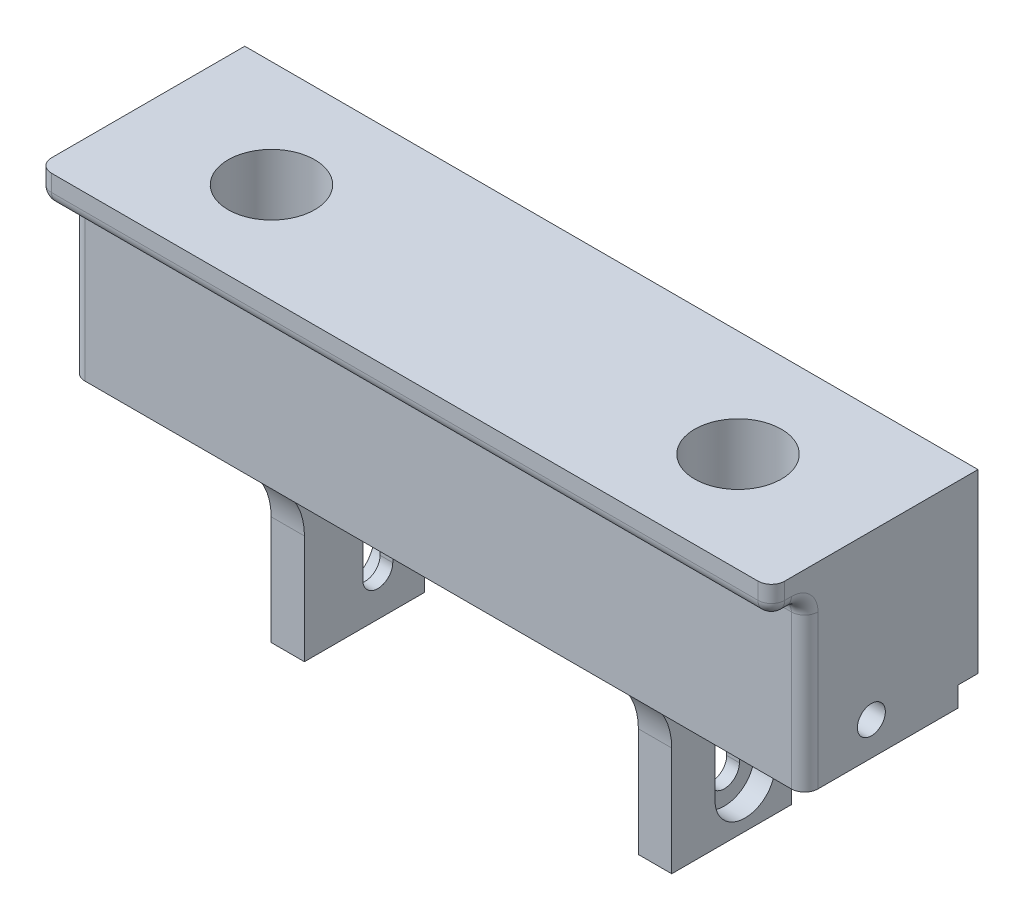
from build123d import *

# Parameters (mm, degrees)
AUFSATZ_LINEAR_AUSTRAGEN2_DEPTH                = 13
STIRNSENKUNG_START                             = 26.95
STIRNSENKUNG_LANGLOCH_F_R_M4_FLACHKOPFSC_DEPTH = 3.1
STIRNSENKUNG_START_2                           = 25.05
STIRNSENKUNG_LANGLOCH_F_R_M4_FLACHKO_3_DEPTH   = 1.9
SCHNITT_LINEAR_AUSTRAGEN1_DEPTH                = 91.954672777
SCHNITT_LINEAR_AUSTRAGEN1_DEPTH_BACK           = 91.954672777
VERRUNDUNG1_R                                  = 10
AUFSATZ_LINEAR_AUSTRAGEN4_REACH                = 65.751
SKIZZE9_W                                      = 3
SKIZZE9_H                                      = 26.5
AUFSATZ_LINEAR_AUSTRAGEN4_DIRECTION_2_REACH    = 65.751
SKIZZE18_W                                     = 110
SKIZZE18_H                                     = 4.5
AUFSATZ_LINEAR_AUSTRAGEN5_DEPTH                = 2
F_4_2_4_2_DURCHMESSER_BOHRUNG1_D               = 4.2
SKIZZE19_R                                     = 6.5
SCHNITT_LINEAR_AUSTRAGEN2_DEPTH                = 11
M5_GEWINDEBOHRUNG1_REACH                       = 73.925
M5_GEWINDEBOHRUNG1_BORE_R                      = 2.1
VERRUNDUNG2_R                                  = 2


# Read off the part's stored shape, not the designer's step: Stirnsenkung Langloch für M4 Flachkopfschraube mit Schlitz12
with BuildPart() as part:
    # Skizze2 → Aufsatz-Linear austragen2 (new, symmetric)
    with BuildSketch(Plane.XY):
        Polygon((-25.05, -25), (-25.05, 0), (25.05, 0), (25.05, -25), (30.05, -25), (30.05, 0), (55, 0), (55, 29.5), (-55, 29.5), (-55, 0), (-30.05, 0), (-30.05, -25), align=None)
    extrude(amount=AUFSATZ_LINEAR_AUSTRAGEN2_DEPTH, both=True)

    # Stirnsenkung Langloch f_r M4 Flachko 2 → Stirnsenkung Langloch für M4 Flachkopfschraube mit Schlitz12 (cut)
    with BuildSketch(Plane.YZ.offset(STIRNSENKUNG_START)):
        with BuildLine():
            Line((-5.25, -1.5), (-18.75, -1.5))
            ThreePointArc((-18.75, -1.5), (-23.25, -6), (-18.75, -10.5))
            Line((-18.75, -10.5), (-5.25, -10.5))
            ThreePointArc((-5.25, -10.5), (-0.75, -6), (-5.25, -1.5))
        make_face()
    stirnsenkung_langloch_f_r_m4_flachkopfsc = extrude(amount=STIRNSENKUNG_LANGLOCH_F_R_M4_FLACHKOPFSC_DEPTH, mode=Mode.SUBTRACT)

    # Stirnsenkung Langloch f_r M4 Flachko 3 o → Stirnsenkung Langloch f_r M4 Flachko 3 (cut)
    with BuildSketch(Plane.YZ.offset(STIRNSENKUNG_START_2)):
        with BuildLine():
            Line((-5.25, -3.75), (-18.75, -3.75))
            ThreePointArc((-18.75, -3.75), (-21, -6), (-18.75, -8.25))
            Line((-18.75, -8.25), (-5.25, -8.25))
            ThreePointArc((-5.25, -8.25), (-3, -6), (-5.25, -3.75))
        make_face()
    stirnsenkung_langloch_f_r_m4_flachko_3 = extrude(amount=STIRNSENKUNG_LANGLOCH_F_R_M4_FLACHKO_3_DEPTH, mode=Mode.SUBTRACT)

    # Skizze5 → Schnitt-Linear austragen1 (cut, two sides: drawn at the far end of the back side and taken through both)
    with BuildSketch(Plane(origin=(30.05, 0, 0), x_dir=(0, 0, -1), z_dir=(1, 0, 0)).offset(-SCHNITT_LINEAR_AUSTRAGEN1_DEPTH_BACK)):
        Polygon((-10, 0), (-10, 25), (-13, 25), (-13, -25), (-5, -25), (-5, 0), align=None)
    extrude(amount=SCHNITT_LINEAR_AUSTRAGEN1_DEPTH + SCHNITT_LINEAR_AUSTRAGEN1_DEPTH_BACK, mode=Mode.SUBTRACT)

    # Verrundung1
    # the kernel refuses this fillet: 10 mm, written as the material it adds along each edge
    with BuildSketch(Plane(origin=(-25.05, 0, 5), x_dir=(0, 0, 1), z_dir=(-1, 0, 0))) as verrundung1_piece_1:
        with BuildLine():
            CenterArc((10, -8.660254038), VERRUNDUNG1_R, 120, 60)
            Line((0, -8.660254038), (-0.2, -8.660254038))
            Line((-0.2, -8.660254038), (-0.2, 0))
            Line((-0.2, 0), (0, 0.2))
            ThreePointArc((0, 0.2), (2.5, 0.2), (4.9, 0.173205081))
            Line((4.9, 0.173205081), (5, 0))
        make_face()
    extrude(amount=5)
    with BuildSketch(Plane(origin=(30.05, 0, 5), x_dir=(0, -1, 0), z_dir=(-1, 0, 0))) as verrundung1_piece_2:
        with BuildLine():
            CenterArc((8.660254038, 10), VERRUNDUNG1_R, 210, 60)
            Line((0, 5), (-0.173205081, 4.9))
            ThreePointArc((-0.173205081, 4.9), (-0.2, 2.5), (-0.2, 0))
            Line((-0.2, 0), (0, -0.2))
            Line((0, -0.2), (8.660254038, -0.2))
            Line((8.660254038, -0.2), (8.660254038, 0))
        make_face()
    extrude(amount=5)

    # Aufsatz-Linear austragen4: up to this face of the body (flat: up to its plane)
    aufsatz_linear_austragen4_end = Plane(part.part.faces().sort_by_distance((55, 14.993858382, -1.246387283))[0])
    # Skizze9 → Aufsatz-Linear austragen4 (add, up to the picked face)
    with BuildSketch(Plane(origin=(0, 0, 0), x_dir=(0, 0, -1), z_dir=(1, 0, 0)), mode=Mode.PRIVATE) as aufsatz_linear_austragen4_sk1:
        with Locations((14.5, 16.25)):
            Rectangle(SKIZZE9_W, SKIZZE9_H)
    aufsatz_linear_austragen4_tool1 = split(extrude(aufsatz_linear_austragen4_sk1.sketch, amount=AUFSATZ_LINEAR_AUSTRAGEN4_REACH, mode=Mode.PRIVATE), bisect_by=aufsatz_linear_austragen4_end, keep=Keep.BOTH, mode=Mode.PRIVATE)
    add(aufsatz_linear_austragen4_tool1.solids().sort_by(Axis((0, 16.25, -14.5), (1, 0, 0)))[0])

    # Aufsatz-Linear austragen4 direction 2: up to this face of the body (flat: up to its plane)
    aufsatz_linear_austragen4_direction_2_end = Plane(part.part.faces().sort_by_distance((-55, 14.993858382, -1.246387283))[0])
    # Skizze9 → Aufsatz-Linear austragen4 direction 2 (add, up to the picked face)
    with BuildSketch(Plane(origin=(0, 0, 0), x_dir=(0, 0, -1), z_dir=(1, 0, 0)), mode=Mode.PRIVATE) as aufsatz_linear_austragen4_direction_2_sk1:
        with Locations((14.5, 16.25)):
            Rectangle(SKIZZE9_W, SKIZZE9_H)
    aufsatz_linear_austragen4_direction_2_tool1 = split(extrude(aufsatz_linear_austragen4_direction_2_sk1.sketch, amount=-AUFSATZ_LINEAR_AUSTRAGEN4_DIRECTION_2_REACH, mode=Mode.PRIVATE), bisect_by=aufsatz_linear_austragen4_direction_2_end, keep=Keep.BOTH, mode=Mode.PRIVATE)
    add(aufsatz_linear_austragen4_direction_2_tool1.solids().sort_by(Axis((0, 16.25, -14.5), (-1, 0, 0)))[0])

    # Skizze18 → Aufsatz-Linear austragen5 (add)
    with BuildSketch(Plane.XY.offset(13)):
        with Locations((0, 27.25)):
            Rectangle(SKIZZE18_W, SKIZZE18_H)
    extrude(amount=AUFSATZ_LINEAR_AUSTRAGEN5_DEPTH)

    # Ø4.2 (4.2) Durchmesser Bohrung1 (through all)
    with Locations(Plane(origin=(55, 0, 0), x_dir=(0, 0, -1), z_dir=(1, 0, 0))):
        with Locations((0, 5)):
            Hole(F_4_2_4_2_DURCHMESSER_BOHRUNG1_D / 2)

    # Spiegeln2: Stirnsenkung Langloch für M4 Flachkopfschraube mit Schlitz12, Stirnsenkung Langloch f_r M4 Flachko 3 across plane
    add(stirnsenkung_langloch_f_r_m4_flachkopfsc.mirror(Plane(origin=(0, 0, 0), x_dir=(0, 0, 1), z_dir=(1, 0, 0))), mode=Mode.SUBTRACT)
    add(stirnsenkung_langloch_f_r_m4_flachko_3.mirror(Plane(origin=(0, 0, 0), x_dir=(0, 0, 1), z_dir=(1, 0, 0))), mode=Mode.SUBTRACT)

    # Skizze19 → Schnitt-Linear austragen2 (cut)
    with BuildSketch(Plane(origin=(0, 29.5, 0), x_dir=(1, 0, 0), z_dir=(0, 1, 0))):
        with Locations(Location((-35, 0, 0), (0, 0, 270))):
            Circle(SKIZZE19_R)
        with Locations(Location((35, 0, 0), (0, 0, 90))):
            Circle(SKIZZE19_R)
    extrude(amount=-SCHNITT_LINEAR_AUSTRAGEN2_DEPTH, mode=Mode.SUBTRACT)

    # M5 Gewindebohrung1 bore → M5 Gewindebohrung1 (cut, up to next)
    with BuildSketch(Plane(origin=(0, 18.5, 0), x_dir=(1, 0, 0), z_dir=(0, 1, 0)), mode=Mode.PRIVATE) as m5_gewindebohrung1_sk1:
        with Locations((-35, 0)):
            Circle(M5_GEWINDEBOHRUNG1_BORE_R)
    m5_gewindebohrung1_tool1 = extrude(m5_gewindebohrung1_sk1.sketch, amount=-M5_GEWINDEBOHRUNG1_REACH, mode=Mode.PRIVATE) & part.part
    m5_gewindebohrung1 = m5_gewindebohrung1_tool1.solids().sort_by_distance((-35, 18.5, 0))[0]
    add(m5_gewindebohrung1, mode=Mode.SUBTRACT)

    # Verrundung2
    verrundung2_edges = [part.edges().sort_by_distance(p)[0] for p in [
        (-55, 27.25, 15),
        (0, 25, 15),
        (55, 27.25, 15),
        (55, 12.5, 10),
        (55, 25, 12.5),
        (-55, 25, 12.5),
        (0, 25, 10),
        (-55, 12.5, 10),
    ]]
    fillet(verrundung2_edges, radius=VERRUNDUNG2_R)

    # Spiegeln3: M5 Gewindebohrung1 across plane
    add(m5_gewindebohrung1.mirror(Plane(origin=(0, 0, 0), x_dir=(0, 0, 1), z_dir=(1, 0, 0))), mode=Mode.SUBTRACT)


solid = part.part
